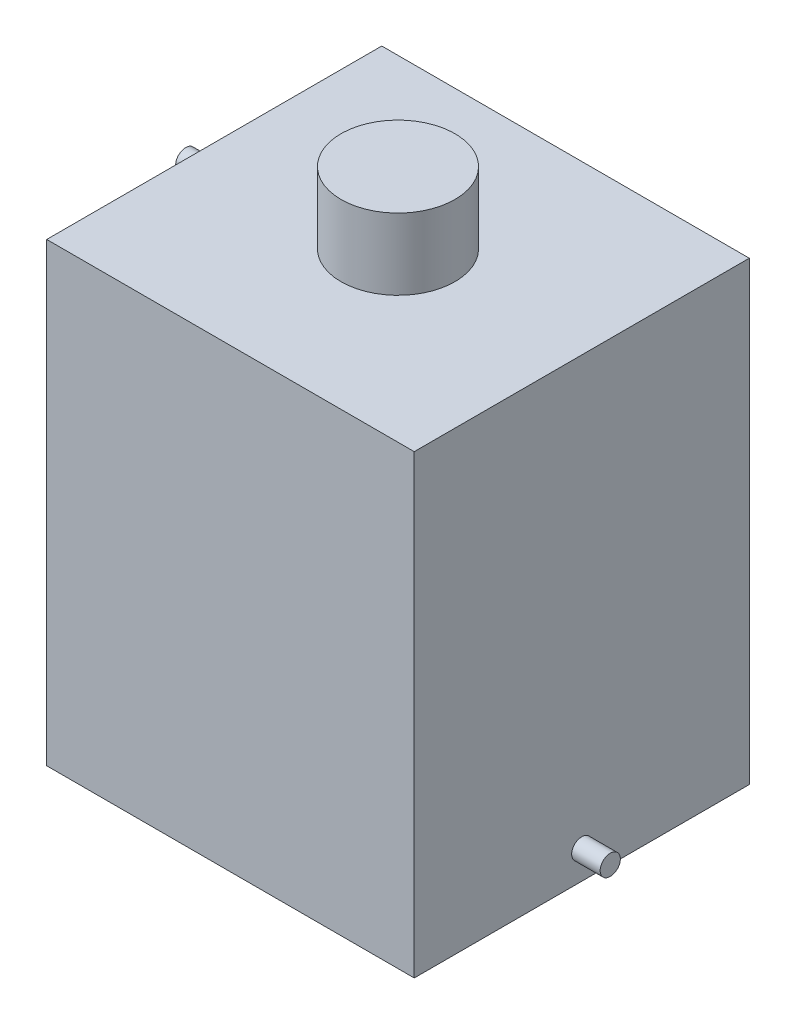
from build123d import *

# Parameters (mm, degrees)
SKETCH1_W           = 163.83
SKETCH1_H           = 149.352
BOSS_EXTRUDE1_DEPTH = 203.2
SKETCH2_R           = 25.4
BOSS_EXTRUDE2_DEPTH = 31.75
SKETCH3_R           = 4.5
BOSS_EXTRUDE3_DEPTH = 12.7
SKETCH5_R           = 4.5
BOSS_EXTRUDE4_DEPTH = 12.7


with BuildPart() as part:
    # Sketch1 → Boss-Extrude1 (new body)
    with BuildSketch(Plane(origin=(0, 0, 0), x_dir=(1, 0, 0), z_dir=(0, 1, 0))):
        Rectangle(SKETCH1_W, SKETCH1_H)
    extrude(amount=BOSS_EXTRUDE1_DEPTH)

    # Sketch2 → Boss-Extrude2 (add)
    with BuildSketch(Plane(origin=(0, 203.2, 0), x_dir=(1, 0, 0), z_dir=(0, 1, 0))):
        Circle(SKETCH2_R)
    extrude(amount=BOSS_EXTRUDE2_DEPTH)

    # Sketch3 → Boss-Extrude3 (add)
    with BuildSketch(Plane.ZY.offset(81.915)):
        with Locations((0, 190.5)):
            Circle(SKETCH3_R)
    extrude(amount=BOSS_EXTRUDE3_DEPTH)

    # Sketch5 → Boss-Extrude4 (add)
    with BuildSketch(Plane(origin=(81.915, 0, 0), x_dir=(0, 0, -1), z_dir=(1, 0, 0))):
        with Locations((0, 12.7)):
            Circle(SKETCH5_R)
    extrude(amount=BOSS_EXTRUDE4_DEPTH)


solid = part.part
